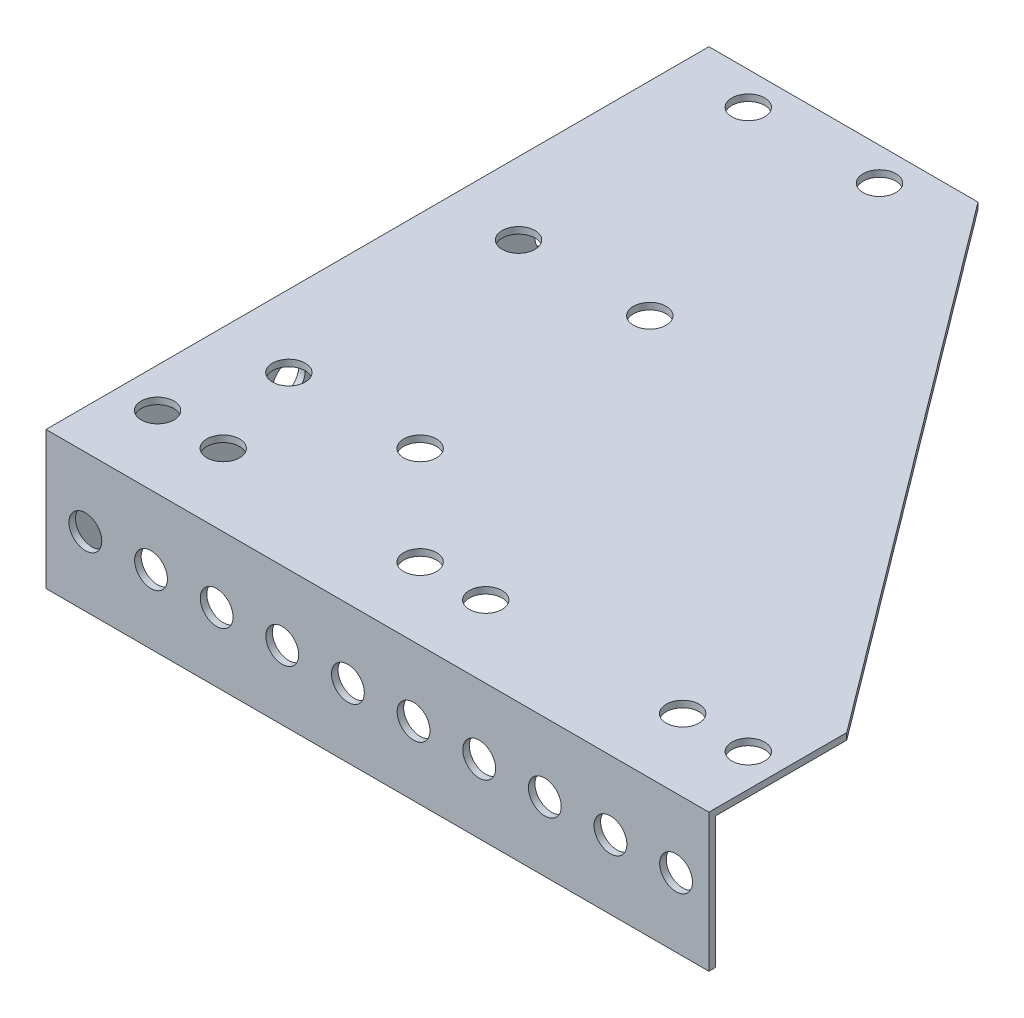
from build123d import *

# Parameters (mm, degrees)
SKETCH1_R           = 2.5
BOSS_EXTRUDE1_DEPTH = 1
SKETCH2_W           = 100
SKETCH2_H           = 21
SKETCH2_R           = 2.5
BOSS_EXTRUDE2_DEPTH = 1
SKETCH3_W           = 101
SKETCH3_H           = 21
SKETCH3_R           = 2.5
BOSS_EXTRUDE5_DEPTH = 1


with BuildPart() as part:
    # Sketch1 → Boss-Extrude1 (new body)
    with BuildSketch(Plane(origin=(0, 0, 0), x_dir=(1, 0, 0), z_dir=(0, 1, 0))):
        Polygon((0, 0), (0, -100), (100, -100), (100, -80), (40, 0), align=None)
        with Locations((10, -5)):
            Circle(SKETCH1_R, mode=Mode.SUBTRACT)
        with Locations((30, -5)):
            Circle(SKETCH1_R, mode=Mode.SUBTRACT)
        with Locations((85, -90)):
            Circle(SKETCH1_R, mode=Mode.SUBTRACT)
        with Locations((95, -90)):
            Circle(SKETCH1_R, mode=Mode.SUBTRACT)
        with Locations((30, -75)):
            Circle(SKETCH1_R, mode=Mode.SUBTRACT)
        with Locations((10, -75)):
            Circle(SKETCH1_R, mode=Mode.SUBTRACT)
        with Locations((5, -90)):
            Circle(SKETCH1_R, mode=Mode.SUBTRACT)
        with Locations((15, -90)):
            Circle(SKETCH1_R, mode=Mode.SUBTRACT)
        with Locations((30, -40)):
            Circle(SKETCH1_R, mode=Mode.SUBTRACT)
        with Locations((10, -40)):
            Circle(SKETCH1_R, mode=Mode.SUBTRACT)
        with Locations((45, -90)):
            Circle(SKETCH1_R, mode=Mode.SUBTRACT)
        with Locations((55, -90)):
            Circle(SKETCH1_R, mode=Mode.SUBTRACT)
    extrude(amount=BOSS_EXTRUDE1_DEPTH)

    # Sketch2 → Boss-Extrude2 (add)
    with BuildSketch(Plane.ZY):
        with Locations((50, -9.5)):
            Rectangle(SKETCH2_W, SKETCH2_H)
        with Locations((5, -10)):
            Circle(SKETCH2_R, mode=Mode.SUBTRACT)
        with Locations((15, -10)):
            Circle(SKETCH2_R, mode=Mode.SUBTRACT)
        with Locations((25, -10)):
            Circle(SKETCH2_R, mode=Mode.SUBTRACT)
        with Locations((35, -10)):
            Circle(SKETCH2_R, mode=Mode.SUBTRACT)
        with Locations((45, -10)):
            Circle(SKETCH2_R, mode=Mode.SUBTRACT)
        with Locations((55, -10)):
            Circle(SKETCH2_R, mode=Mode.SUBTRACT)
        with Locations((65, -10)):
            Circle(SKETCH2_R, mode=Mode.SUBTRACT)
        with Locations((75, -10)):
            Circle(SKETCH2_R, mode=Mode.SUBTRACT)
    extrude(amount=BOSS_EXTRUDE2_DEPTH)

    # Sketch3 → Boss-Extrude5 (add)
    with BuildSketch(Plane.XY.offset(100)):
        with Locations((49.5, -9.5)):
            Rectangle(SKETCH3_W, SKETCH3_H)
        with Locations((95, -9.5)):
            Circle(SKETCH3_R, mode=Mode.SUBTRACT)
        with Locations((85, -9.5)):
            Circle(SKETCH3_R, mode=Mode.SUBTRACT)
        with Locations((75, -9.5)):
            Circle(SKETCH3_R, mode=Mode.SUBTRACT)
        with Locations((65, -9.5)):
            Circle(SKETCH3_R, mode=Mode.SUBTRACT)
        with Locations((55, -9.5)):
            Circle(SKETCH3_R, mode=Mode.SUBTRACT)
        with Locations((45, -9.5)):
            Circle(SKETCH3_R, mode=Mode.SUBTRACT)
        with Locations((35, -9.5)):
            Circle(SKETCH3_R, mode=Mode.SUBTRACT)
        with Locations((25, -9.5)):
            Circle(SKETCH3_R, mode=Mode.SUBTRACT)
        with Locations((15, -9.5)):
            Circle(SKETCH3_R, mode=Mode.SUBTRACT)
        with Locations((5, -9.5)):
            Circle(SKETCH3_R, mode=Mode.SUBTRACT)
    extrude(amount=BOSS_EXTRUDE5_DEPTH)


solid = part.part
